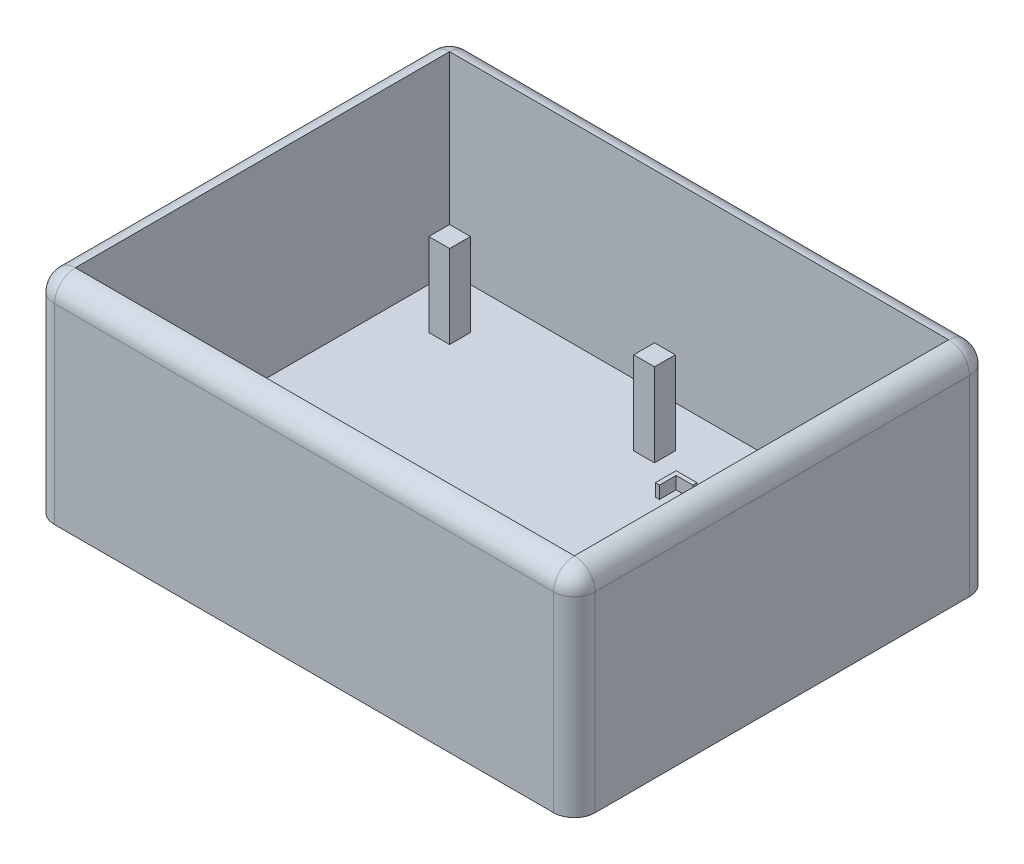
from build123d import *

# Parameters (mm, degrees)
SKETCH1_W           = 130
SKETCH1_H           = 100
BOSS_EXTRUDE1_DEPTH = 51
SKETCH2_W           = 120
SKETCH2_H           = 90
CUT_EXTRUDE1_DEPTH  = 46
FILLET2_R           = 5
FILLET4_R           = 5
SKETCH6_W           = 5
SKETCH6_H           = 5
BOSS_EXTRUDE2_DEPTH = 20
BOSS_EXTRUDE3_DEPTH = 3


# Some blends are built 0.0001 mm under size
with BuildPart() as part:
    # Sketch1 → Boss-Extrude1 (new body)
    with BuildSketch(Plane(origin=(0, 0, 0), x_dir=(1, 0, 0), z_dir=(0, 1, 0))):
        Rectangle(SKETCH1_W, SKETCH1_H)
    extrude(amount=BOSS_EXTRUDE1_DEPTH)

    # Sketch2 → Cut-Extrude1 (cut)
    with BuildSketch(Plane(origin=(0, 51, 0), x_dir=(1, 0, 0), z_dir=(0, 1, 0))):
        Rectangle(SKETCH2_W, SKETCH2_H)
    extrude(amount=-CUT_EXTRUDE1_DEPTH, mode=Mode.SUBTRACT)

    # Fillet2
    fillet2_edges = [part.edges().sort_by_distance(p)[0] for p in [
        (-65, 51, 0),
        (0, 51, 50),
        (65, 51, 0),
        (0, 51, -50),
    ]]
    fillet(fillet2_edges, radius=FILLET2_R - 0.0001)  # a hair under: the kernel refuses the full size

    # Fillet4
    # the kernel refuses this fillet: 5 mm, written as the material it takes off along each edge
    with BuildSketch(Plane(origin=(60, 51, 45), x_dir=(0, 0, 1), z_dir=(-1, 0, 0))) as fillet4_piece_1:
        with BuildLine():
            CenterArc((0.0001, -4.9999), 4.9999, 0, 90)
            Line((5, -4.9999), (5, 0))
            Line((5, 0), (0.0001, 0))
        make_face()
    revolve(axis=Axis((60, 51, 45), (0, 1, 0)), revolution_arc=90, mode=Mode.SUBTRACT)
    with BuildSketch(Plane(origin=(-60, 51, 45), x_dir=(-1, 0, 0), z_dir=(0, 0, -1))) as fillet4_piece_2:
        with BuildLine():
            CenterArc((0.0001, -4.9999), 4.9999, 0, 90)
            Line((5, -4.9999), (5, 0))
            Line((5, 0), (0.0001, 0))
        make_face()
    revolve(axis=Axis((-60, 51, 45), (0, 1, 0)), revolution_arc=90, mode=Mode.SUBTRACT)
    with BuildSketch(Plane(origin=(60, 51, -45), x_dir=(1, 0, 0), z_dir=(0, 0, 1))) as fillet4_piece_3:
        with BuildLine():
            CenterArc((0.0001, -4.9999), 4.9999, 0, 90)
            Line((5, -4.9999), (5, 0))
            Line((5, 0), (0.0001, 0))
        make_face()
    revolve(axis=Axis((60, 51, -45), (0, 1, 0)), revolution_arc=90, mode=Mode.SUBTRACT)
    with BuildSketch(Plane(origin=(-60, 51, -45), x_dir=(0, 0, -1), z_dir=(1, 0, 0))) as fillet4_piece_4:
        with BuildLine():
            CenterArc((0.0001, -4.9999), 4.9999, 0, 90)
            Line((5, -4.9999), (5, 0))
            Line((5, 0), (0.0001, 0))
        make_face()
    revolve(axis=Axis((-60, 51, -45), (0, 1, 0)), revolution_arc=90, mode=Mode.SUBTRACT)
    with BuildSketch(Plane(origin=(-65, -12.5, -50), x_dir=(1, 0, 0), z_dir=(0, 1, 0)), Plane(origin=(-65, -12.5, 50), x_dir=(0, 0, -1), z_dir=(0, 1, 0))) as fillet4_piece_5:
        with BuildLine():
            CenterArc((FILLET4_R, -FILLET4_R), FILLET4_R, 90, 90)
            Line((0, -FILLET4_R), (0, 0))
            Line((0, 0), (FILLET4_R, 0))
        make_face()
    extrude(amount=63.5, mode=Mode.SUBTRACT)
    with BuildSketch(Plane(origin=(65, -12.5, -50), x_dir=(-1, 0, 0), z_dir=(0, 1, 0)), Plane(origin=(65, -12.5, 50), x_dir=(0, 0, -1), z_dir=(0, 1, 0))) as fillet4_piece_6:
        with BuildLine():
            CenterArc((FILLET4_R, FILLET4_R), FILLET4_R, 180, 90)
            Line((0, FILLET4_R), (0, 0))
            Line((0, 0), (FILLET4_R, 0))
        make_face()
    extrude(amount=63.5, mode=Mode.SUBTRACT)

    # Sketch6 → Boss-Extrude2 (add)
    with BuildSketch(Plane(origin=(0, 5, 0), x_dir=(1, 0, 0), z_dir=(0, 1, 0))):
        with Locations((-47.5, 32.5)):
            Rectangle(SKETCH6_W, SKETCH6_H)
        with Locations((-47.5, -31.53)):
            Rectangle(SKETCH6_W, SKETCH6_H)
        with Locations((1.77, 32.5)):
            Rectangle(SKETCH6_W, SKETCH6_H)
        with Locations((1.77, -31.53)):
            Rectangle(SKETCH6_W, SKETCH6_H)
    extrude(amount=BOSS_EXTRUDE2_DEPTH)

    # Sketch9 → Boss-Extrude3 (add)
    with BuildSketch(Plane(origin=(0, 5, 0), x_dir=(1, 0, 0), z_dir=(0, 1, 0))):
        Polygon((11.5, -14.03), (11.5, -19.03), (16.5, -19.03), (16.5, -18.03), (12.5, -18.03), (12.5, -14.03), align=None)
        Polygon((11.5, 27.97), (16.5, 27.97), (16.5, 26.97), (12.5, 26.97), (12.5, 22.97), (11.5, 22.97), align=None)
        Polygon((40, 27.97), (40, 22.97), (39, 22.97), (39, 26.97), (35, 26.97), (35, 27.97), align=None)
        Polygon((40, -19.03), (35, -19.03), (35, -18.03), (39, -18.03), (39, -14.03), (40, -14.03), align=None)
    extrude(amount=BOSS_EXTRUDE3_DEPTH)


solid = part.part
